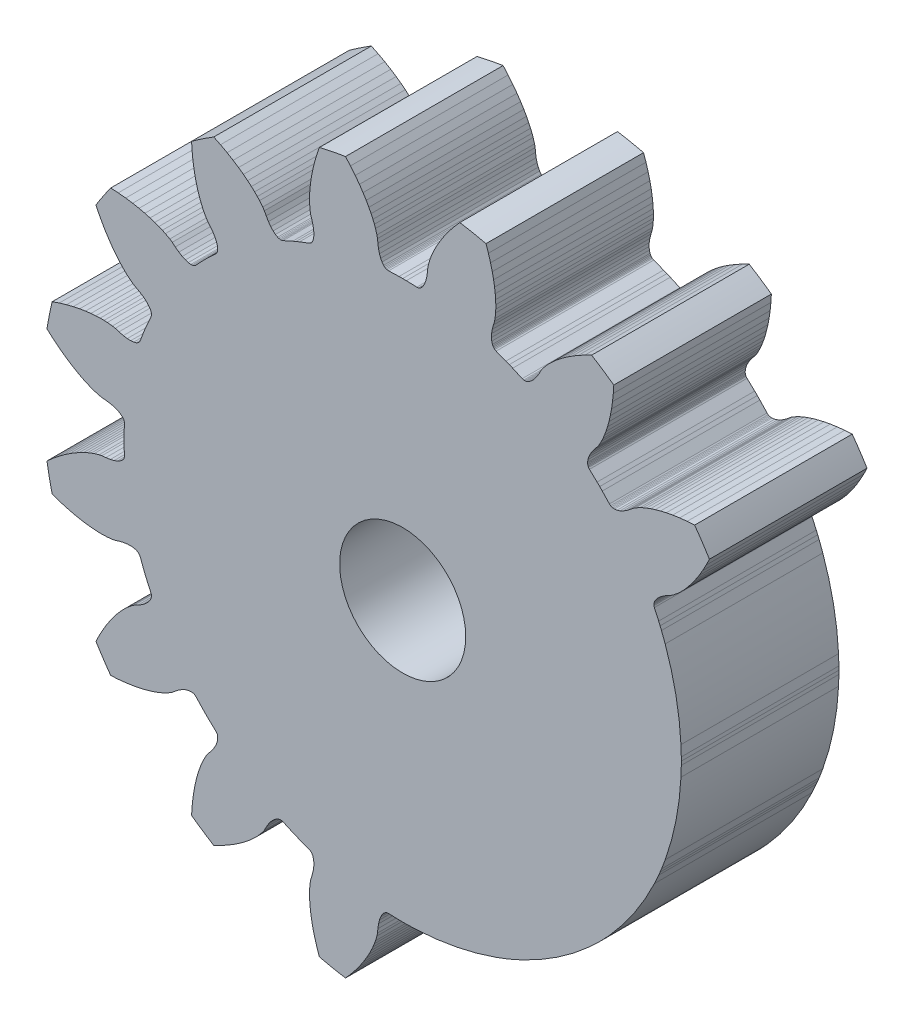
from build123d import *

# Parameters (mm, degrees)
MODEL_R             = 2
BOSS_EXTRUDE1_DEPTH = 5
CUT_EXTRUDE1_DEPTH  = 5


with BuildPart() as part:
    # Model → Boss-Extrude1 (new body)
    with BuildSketch(Plane.XY):
        with BuildLine():
            Line((0.6463668, -5.5709209), (0.5329274, -5.7804302))
            Line((0.5329274, -5.7804302), (0.428128836, -5.994577478))
            ThreePointArc((0.428128836, -5.994577478), (0.656324717, -6.350152722), (0.897506636, -6.697050974))
            Line((0.897506636, -6.697050974), (1.1354576, -6.6821803))
            Line((1.1354576, -6.6821803), (1.3724303, -6.6575518))
            Line((1.3724303, -6.6575518), (1.5929416, -6.6252582))
            Line((1.5929416, -6.6252582), (1.7947923, -6.5870179))
            Line((1.7947923, -6.5870179), (1.9798633, -6.5438349))
            Line((1.9798633, -6.5438349), (2.1448667, -6.497979))
            Line((2.1448667, -6.497979), (2.2934298, -6.4499099))
            Line((2.2934298, -6.4499099), (2.4236011, -6.4016922))
            Line((2.4236011, -6.4016922), (2.5361725, -6.3545282))
            Line((2.5361725, -6.3545282), (2.6306986, -6.3102209))
            Line((2.6306986, -6.3102209), (2.7717664, -6.2333867))
            Line((2.7717664, -6.2333867), (2.8499936, -6.1820578))
            Line((2.8499936, -6.1820578), (2.9454601, -6.1014971))
            Line((2.9454601, -6.1014971), (3.0591558, -6.0163968))
            Line((3.0591558, -6.0163968), (3.1666784, -5.9511309))
            Line((3.1666784, -5.9511309), (3.2665997, -5.9050063))
            Line((3.2665997, -5.9050063), (3.3574983, -5.8772524))
            Line((3.3574983, -5.8772524), (3.4380589, -5.8670064))
            Line((3.4380589, -5.8670064), (3.4740507, -5.8681519))
            Line((3.4740507, -5.8681519), (3.5069736, -5.8733279))
            Line((3.5069736, -5.8733279), (3.5366862, -5.8823789))
            Line((3.5366862, -5.8823789), (3.5630259, -5.8951987))
            Line((3.5630259, -5.8951987), (3.6006086, -5.9262336))
            Line((3.6006086, -5.9262336), (3.8275404, -6.1681561))
            Line((3.8275404, -6.1681561), (3.9091759, -6.2508239))
            Line((3.9091759, -6.2508239), (3.9918438, -6.3324594))
            Line((3.9918438, -6.3324594), (4.2337662, -6.5593912))
            Line((4.2337662, -6.5593912), (4.2648011, -6.5969739))
            Line((4.2648011, -6.5969739), (4.277621, -6.6233137))
            Line((4.277621, -6.6233137), (4.2866719, -6.6530263))
            Line((4.2866719, -6.6530263), (4.2918479, -6.6859492))
            Line((4.2918479, -6.6859492), (4.2929935, -6.7219409))
            Line((4.2929935, -6.7219409), (4.2827475, -6.8025016))
            Line((4.2827475, -6.8025016), (4.2549935, -6.8934002))
            Line((4.2549935, -6.8934002), (4.208869, -6.9933214))
            Line((4.208869, -6.9933214), (4.143603, -7.1008441))
            Line((4.143603, -7.1008441), (4.0585027, -7.2145398))
            Line((4.0585027, -7.2145398), (3.977942, -7.3100063))
            Line((3.977942, -7.3100063), (3.9266132, -7.3882335))
            Line((3.9266132, -7.3882335), (3.8497789, -7.5293013))
            Line((3.8497789, -7.5293013), (3.8054716, -7.6238273))
            Line((3.8054716, -7.6238273), (3.7583076, -7.7363987))
            Line((3.7583076, -7.7363987), (3.71009, -7.86657))
            Line((3.71009, -7.86657), (3.6620209, -8.0151331))
            Line((3.6620209, -8.0151331), (3.616165, -8.1801365))
            Line((3.616165, -8.1801365), (3.572982, -8.3652076))
            Line((3.572982, -8.3652076), (3.5347416, -8.5670583))
            Line((3.5347416, -8.5670583), (3.5024481, -8.7875695))
            Line((3.5024481, -8.7875695), (3.4778196, -9.0245422))
            Line((3.4778196, -9.0245422), (3.462948926, -9.262493164))
            ThreePointArc((3.462948926, -9.262493164), (3.809847597, -9.503674455), (4.165422422, -9.731870964))
            Line((4.165422422, -9.731870964), (4.3795697, -9.6270724))
            Line((4.3795697, -9.6270724), (4.589079, -9.5136331))
            Line((4.589079, -9.5136331), (4.7804466, -9.3994117))
            Line((4.7804466, -9.3994117), (4.9522984, -9.2868373))
            Line((4.9522984, -9.2868373), (5.1067563, -9.1761178))
            Line((5.1067563, -9.1761178), (5.2416513, -9.0706084))
            Line((5.2416513, -9.0706084), (5.3605105, -8.9693457))
            Line((5.3605105, -8.9693457), (5.462321, -8.8749841))
            Line((5.462321, -8.8749841), (5.5482745, -8.788331))
            Line((5.5482745, -8.788331), (5.6186495, -8.7112228))
            Line((5.6186495, -8.7112228), (5.719576, -8.5862529))
            Line((5.719576, -8.5862529), (5.7722058, -8.508895))
            Line((5.7722058, -8.508895), (5.8295761, -8.3979332))
            Line((5.8295761, -8.3979332), (5.9020507, -8.2758013))
            Line((5.9020507, -8.2758013), (5.9764125, -8.1743563))
            Line((5.9764125, -8.1743563), (6.0510766, -8.0935045))
            Line((6.0510766, -8.0935045), (6.124435, -8.0330778))
            Line((6.124435, -8.0330778), (6.1949424, -7.9927825))
            Line((6.1949424, -7.9927825), (6.2286328, -7.9800674))
            Line((6.2286328, -7.9800674), (6.2610303, -7.9722504))
            Line((6.2610303, -7.9722504), (6.2919449, -7.9692419))
            Line((6.2919449, -7.9692419), (6.3211855, -7.9710061))
            Line((6.3211855, -7.9710061), (6.367784, -7.9852963))
            Line((6.367784, -7.9852963), (6.6700213, -8.1219605))
            Line((6.6700213, -8.1219605), (6.7770783, -8.1670951))
            Line((6.7770783, -8.1670951), (6.884694, -8.2108808))
            Line((6.884694, -8.2108808), (7.1950442, -8.3279587))
            Line((7.1950442, -8.3279587), (7.238099, -8.3508041))
            Line((7.238099, -8.3508041), (7.2600228, -8.3702329))
            Line((7.2600228, -8.3702329), (7.2797553, -8.3942201))
            Line((7.2797553, -8.3942201), (7.2971364, -8.4226561))
            Line((7.2971364, -8.4226561), (7.3119682, -8.4554698))
            Line((7.3119682, -8.4554698), (7.3333313, -8.5338191))
            Line((7.3333313, -8.5338191), (7.3424754, -8.6284194))
            Line((7.3424754, -8.6284194), (7.3381001, -8.7383857))
            Line((7.3381001, -8.7383857), (7.3189493, -8.8626999))
            Line((7.3189493, -8.8626999), (7.2838364, -9.0003075))
            Line((7.2838364, -9.0003075), (7.2459415, -9.1193363))
            Line((7.2459415, -9.1193363), (7.228456, -9.2112515))
            Line((7.228456, -9.2112515), (7.2114548, -9.3709844))
            Line((7.2114548, -9.3709844), (7.2066937, -9.4752707))
            Line((7.2066937, -9.4752707), (7.206199, -9.597322))
            Line((7.206199, -9.597322), (7.2114662, -9.7360367))
            Line((7.2114662, -9.7360367), (7.2239087, -9.8916864))
            Line((7.2239087, -9.8916864), (7.2446875, -10.0616779))
            Line((7.2446875, -10.0616779), (7.2756152, -10.2491867))
            Line((7.2756152, -10.2491867), (7.3175307, -10.4503063))
            Line((7.3175307, -10.4503063), (7.3720813, -10.6663904))
            Line((7.3720813, -10.6663904), (7.440013, -10.8947495))
            Line((7.440013, -10.8947495), (7.517334202, -11.120278282))
            ThreePointArc((7.517334202, -11.120278282), (7.930122801, -11.210348752), (8.345958208, -11.285101885))
            Line((8.345958208, -11.285101885), (8.5036998, -11.10633))
            Line((8.5036998, -11.10633), (8.6538498, -10.92135))
            Line((8.6538498, -10.92135), (8.7869398, -10.74259))
            Line((8.7869398, -10.74259), (8.9026298, -10.57282))
            Line((8.9026298, -10.57282), (9.0029598, -10.41142))
            Line((9.0029598, -10.41142), (9.0872098, -10.26232))
            Line((9.0872098, -10.26232), (9.1582698, -10.12328))
            Line((9.1582698, -10.12328), (9.2162198, -9.99714))
            Line((9.2162198, -9.99714), (9.2624698, -9.88419))
            Line((9.2624698, -9.88419), (9.2979798, -9.78602))
            Line((9.2979798, -9.78602), (9.3433998, -9.63194))
            Line((9.3433998, -9.63194), (9.3624198, -9.54033))
            Line((9.3624198, -9.54033), (9.3729598, -9.41586))
            Line((9.3729598, -9.41586), (9.3931798, -9.27529))
            Line((9.3931798, -9.27529), (9.4230598, -9.15311))
            Line((9.4230598, -9.15311), (9.4610998, -9.04984))
            Line((9.4610998, -9.04984), (9.5057498, -8.96594))
            Line((9.5057498, -8.96594), (9.5554698, -8.90173))
            Line((9.5554698, -8.90173), (9.5817298, -8.87709))
            Line((9.5817298, -8.87709), (9.6086698, -8.85747))
            Line((9.6086698, -8.85747), (9.6360798, -8.84286))
            Line((9.6360798, -8.84286), (9.6637698, -8.8333))
            Line((9.6637698, -8.8333), (9.7122898, -8.82867))
            Line((9.7122898, -8.82867), (10.0438198, -8.83927))
            Line((10.0438198, -8.83927), (10.1599998, -8.84))
            Line((10.1599998, -8.84), (10.2761798, -8.83927))
            Line((10.2761798, -8.83927), (10.6077098, -8.82867))
            Line((10.6077098, -8.82867), (10.6562298, -8.8333))
            Line((10.6562298, -8.8333), (10.6839198, -8.84286))
            Line((10.6839198, -8.84286), (10.7113298, -8.85747))
            Line((10.7113298, -8.85747), (10.7382698, -8.87709))
            Line((10.7382698, -8.87709), (10.7645298, -8.90173))
            Line((10.7645298, -8.90173), (10.8142498, -8.96594))
            Line((10.8142498, -8.96594), (10.8588998, -9.04984))
            Line((10.8588998, -9.04984), (10.8969398, -9.15311))
            Line((10.8969398, -9.15311), (10.9268198, -9.27529))
            Line((10.9268198, -9.27529), (10.9470398, -9.41586))
            Line((10.9470398, -9.41586), (10.9575798, -9.54033))
            Line((10.9575798, -9.54033), (10.9765998, -9.63194))
            Line((10.9765998, -9.63194), (11.0220198, -9.78602))
            Line((11.0220198, -9.78602), (11.0575298, -9.88419))
            Line((11.0575298, -9.88419), (11.1037798, -9.99714))
            Line((11.1037798, -9.99714), (11.1617298, -10.12328))
            Line((11.1617298, -10.12328), (11.2327898, -10.26232))
            Line((11.2327898, -10.26232), (11.3170398, -10.41142))
            Line((11.3170398, -10.41142), (11.4173698, -10.57282))
            Line((11.4173698, -10.57282), (11.5330598, -10.74259))
            Line((11.5330598, -10.74259), (11.6661498, -10.92135))
            Line((11.6661498, -10.92135), (11.8162998, -11.10633))
            Line((11.8162998, -11.10633), (11.974041492, -11.285101985))
            ThreePointArc((11.974041492, -11.285101985), (12.389876826, -11.210348484), (12.802665498, -11.120278382))
            Line((12.802665498, -11.120278382), (12.8799867, -10.8947495))
            Line((12.8799867, -10.8947495), (12.9479184, -10.6663904))
            Line((12.9479184, -10.6663904), (13.002469, -10.4503063))
            Line((13.002469, -10.4503063), (13.0443845, -10.2491867))
            Line((13.0443845, -10.2491867), (13.0753122, -10.0616779))
            Line((13.0753122, -10.0616779), (13.096091, -9.8916864))
            Line((13.096091, -9.8916864), (13.1085335, -9.7360367))
            Line((13.1085335, -9.7360367), (13.1138007, -9.597322))
            Line((13.1138007, -9.597322), (13.113306, -9.4752707))
            Line((13.113306, -9.4752707), (13.1085449, -9.3709844))
            Line((13.1085449, -9.3709844), (13.0915437, -9.2112515))
            Line((13.0915437, -9.2112515), (13.0740582, -9.1193363))
            Line((13.0740582, -9.1193363), (13.0361633, -9.0003075))
            Line((13.0361633, -9.0003075), (13.0010504, -8.8626999))
            Line((13.0010504, -8.8626999), (12.9818996, -8.7383857))
            Line((12.9818996, -8.7383857), (12.9775243, -8.6284194))
            Line((12.9775243, -8.6284194), (12.9866684, -8.5338191))
            Line((12.9866684, -8.5338191), (13.0080315, -8.4554698))
            Line((13.0080315, -8.4554698), (13.0228633, -8.4226561))
            Line((13.0228633, -8.4226561), (13.0402444, -8.3942201))
            Line((13.0402444, -8.3942201), (13.0599769, -8.3702329))
            Line((13.0599769, -8.3702329), (13.0819007, -8.3508041))
            Line((13.0819007, -8.3508041), (13.1249555, -8.3279587))
            Line((13.1249555, -8.3279587), (13.4353057, -8.2108808))
            Line((13.4353057, -8.2108808), (13.5429214, -8.1670951))
            Line((13.5429214, -8.1670951), (13.6499784, -8.1219605))
            Line((13.6499784, -8.1219605), (13.9522157, -7.9852963))
            Line((13.9522157, -7.9852963), (13.9988142, -7.9710061))
            Line((13.9988142, -7.9710061), (14.0280548, -7.9692419))
            Line((14.0280548, -7.9692419), (14.0589694, -7.9722504))
            Line((14.0589694, -7.9722504), (14.0913669, -7.9800674))
            Line((14.0913669, -7.9800674), (14.1250573, -7.9927825))
            Line((14.1250573, -7.9927825), (14.1955647, -8.0330778))
            Line((14.1955647, -8.0330778), (14.2689231, -8.0935045))
            Line((14.2689231, -8.0935045), (14.3435872, -8.1743563))
            Line((14.3435872, -8.1743563), (14.417949, -8.2758013))
            Line((14.417949, -8.2758013), (14.4904236, -8.3979332))
            Line((14.4904236, -8.3979332), (14.5477939, -8.508895))
            Line((14.5477939, -8.508895), (14.6004237, -8.5862529))
            Line((14.6004237, -8.5862529), (14.7013502, -8.7112228))
            Line((14.7013502, -8.7112228), (14.7717252, -8.788331))
            Line((14.7717252, -8.788331), (14.8576787, -8.8749841))
            Line((14.8576787, -8.8749841), (14.9594892, -8.9693457))
            Line((14.9594892, -8.9693457), (15.0783484, -9.0706084))
            Line((15.0783484, -9.0706084), (15.2132434, -9.1761178))
            Line((15.2132434, -9.1761178), (15.3677013, -9.2868373))
            Line((15.3677013, -9.2868373), (15.5395531, -9.3994117))
            Line((15.5395531, -9.3994117), (15.7309207, -9.5136331))
            Line((15.7309207, -9.5136331), (15.94043, -9.6270724))
            Line((15.94043, -9.6270724), (16.154577278, -9.731870964))
            ThreePointArc((16.154577278, -9.731870964), (16.510152313, -9.503674769), (16.857050774, -9.262493164))
            Line((16.857050774, -9.262493164), (16.8421801, -9.0245422))
            Line((16.8421801, -9.0245422), (16.8175516, -8.7875695))
            Line((16.8175516, -8.7875695), (16.785258, -8.5670583))
            Line((16.785258, -8.5670583), (16.7470177, -8.3652076))
            Line((16.7470177, -8.3652076), (16.7038347, -8.1801365))
            Line((16.7038347, -8.1801365), (16.6579788, -8.0151331))
            Line((16.6579788, -8.0151331), (16.6099097, -7.86657))
            Line((16.6099097, -7.86657), (16.5616921, -7.7363987))
            Line((16.5616921, -7.7363987), (16.5145281, -7.6238273))
            Line((16.5145281, -7.6238273), (16.4702208, -7.5293013))
            Line((16.4702208, -7.5293013), (16.3933865, -7.3882335))
            Line((16.3933865, -7.3882335), (16.3420577, -7.3100063))
            Line((16.3420577, -7.3100063), (16.261497, -7.2145398))
            Line((16.261497, -7.2145398), (16.1763967, -7.1008441))
            Line((16.1763967, -7.1008441), (16.1111307, -6.9933214))
            Line((16.1111307, -6.9933214), (16.0650062, -6.8934002))
            Line((16.0650062, -6.8934002), (16.0372522, -6.8025016))
            Line((16.0372522, -6.8025016), (16.0270062, -6.7219409))
            Line((16.0270062, -6.7219409), (16.0281517, -6.6859492))
            Line((16.0281517, -6.6859492), (16.0333278, -6.6530263))
            Line((16.0333278, -6.6530263), (16.0423787, -6.6233137))
            Line((16.0423787, -6.6233137), (16.0551986, -6.5969739))
            Line((16.0551986, -6.5969739), (16.0862335, -6.5593912))
            Line((16.0862335, -6.5593912), (16.3281559, -6.3324594))
            Line((16.3281559, -6.3324594), (16.4108238, -6.2508239))
            Line((16.4108238, -6.2508239), (16.4924593, -6.1681561))
            Line((16.4924593, -6.1681561), (16.7193911, -5.9262336))
            Line((16.7193911, -5.9262336), (16.7569738, -5.8951987))
            Line((16.7569738, -5.8951987), (16.7833135, -5.8823789))
            Line((16.7833135, -5.8823789), (16.8130261, -5.8733279))
            Line((16.8130261, -5.8733279), (16.845949, -5.8681519))
            Line((16.845949, -5.8681519), (16.8819408, -5.8670064))
            Line((16.8819408, -5.8670064), (16.9625014, -5.8772524))
            Line((16.9625014, -5.8772524), (17.0534, -5.9050063))
            Line((17.0534, -5.9050063), (17.1533213, -5.9511309))
            Line((17.1533213, -5.9511309), (17.2608439, -6.0163968))
            Line((17.2608439, -6.0163968), (17.3745396, -6.1014971))
            Line((17.3745396, -6.1014971), (17.4700061, -6.1820578))
            Line((17.4700061, -6.1820578), (17.5482333, -6.2333867))
            Line((17.5482333, -6.2333867), (17.6893011, -6.3102209))
            Line((17.6893011, -6.3102209), (17.7838272, -6.3545282))
            Line((17.7838272, -6.3545282), (17.8963986, -6.4016922))
            Line((17.8963986, -6.4016922), (18.0265699, -6.4499099))
            Line((18.0265699, -6.4499099), (18.175133, -6.497979))
            Line((18.175133, -6.497979), (18.3401364, -6.5438349))
            Line((18.3401364, -6.5438349), (18.5252074, -6.5870179))
            Line((18.5252074, -6.5870179), (18.7270581, -6.6252582))
            Line((18.7270581, -6.6252582), (18.9475694, -6.6575518))
            Line((18.9475694, -6.6575518), (19.1845421, -6.6821803))
            Line((19.1845421, -6.6821803), (19.422493064, -6.697050974))
            ThreePointArc((19.422493064, -6.697050974), (19.663674357, -6.350152304), (19.891870864, -5.994577478))
            Line((19.891870864, -5.994577478), (19.7870722, -5.7804302))
            Line((19.7870722, -5.7804302), (19.6736329, -5.5709209))
            Line((19.6736329, -5.5709209), (19.5594116, -5.3795532))
            Line((19.5594116, -5.3795532), (19.4468372, -5.2077015))
            Line((19.4468372, -5.2077015), (19.3361177, -5.0532435))
            Line((19.3361177, -5.0532435), (19.2306083, -4.9183486))
            Line((19.2306083, -4.9183486), (19.1293456, -4.7994894))
            Line((19.1293456, -4.7994894), (19.0349839, -4.6976789))
            Line((19.0349839, -4.6976789), (18.9483308, -4.6117254))
            Line((18.9483308, -4.6117254), (18.8712227, -4.5413504))
            Line((18.8712227, -4.5413504), (18.7462528, -4.4404239))
            Line((18.7462528, -4.4404239), (18.6688948, -4.3877941))
            Line((18.6688948, -4.3877941), (18.557933, -4.3304238))
            Line((18.557933, -4.3304238), (18.4358011, -4.2579491))
            Line((18.4358011, -4.2579491), (18.3343561, -4.1835873))
            Line((18.3343561, -4.1835873), (18.2535043, -4.1089232))
            Line((18.2535043, -4.1089232), (18.1930777, -4.0355649))
            Line((18.1930777, -4.0355649), (18.1527824, -3.9650575))
            Line((18.1527824, -3.9650575), (18.1400673, -3.9313671))
            Line((18.1400673, -3.9313671), (18.1322502, -3.8989695))
            Line((18.1322502, -3.8989695), (18.1292417, -3.868055))
            Line((18.1292417, -3.868055), (18.1310059, -3.8388143))
            Line((18.1310059, -3.8388143), (18.1452962, -3.7922158))
            Line((18.1452962, -3.7922158), (18.2819603, -3.4899785))
            Line((18.2819603, -3.4899785), (18.3270949, -3.3829215))
            Line((18.3270949, -3.3829215), (18.3708806, -3.2753059))
            Line((18.3708806, -3.2753059), (18.4879586, -2.9649556))
            Line((18.4879586, -2.9649556), (18.5108039, -2.9219008))
            Line((18.5108039, -2.9219008), (18.5302327, -2.8999771))
            Line((18.5302327, -2.8999771), (18.5542199, -2.8802445))
            Line((18.5542199, -2.8802445), (18.582656, -2.8628635))
            Line((18.582656, -2.8628635), (18.6154696, -2.8480317))
            Line((18.6154696, -2.8480317), (18.6938189, -2.8266685))
            Line((18.6938189, -2.8266685), (18.7884192, -2.8175244))
            Line((18.7884192, -2.8175244), (18.8983856, -2.8218998))
            Line((18.8983856, -2.8218998), (19.0226997, -2.8410505))
            Line((19.0226997, -2.8410505), (19.1603074, -2.8761635))
            Line((19.1603074, -2.8761635), (19.2793361, -2.9140584))
            Line((19.2793361, -2.9140584), (19.3712514, -2.9315438))
            Line((19.3712514, -2.9315438), (19.5309842, -2.9485451))
            Line((19.5309842, -2.9485451), (19.6352705, -2.9533062))
            Line((19.6352705, -2.9533062), (19.7573218, -2.9538008))
            Line((19.7573218, -2.9538008), (19.8960365, -2.9485337))
            Line((19.8960365, -2.9485337), (20.0516862, -2.9360911))
            Line((20.0516862, -2.9360911), (20.2216777, -2.9153124))
            Line((20.2216777, -2.9153124), (20.4091865, -2.8843846))
            Line((20.4091865, -2.8843846), (20.6103062, -2.8424692))
            Line((20.6103062, -2.8424692), (20.8263902, -2.7879185))
            Line((20.8263902, -2.7879185), (21.0547494, -2.7199868))
            Line((21.0547494, -2.7199868), (21.280278182, -2.642665598))
            ThreePointArc((21.280278182, -2.642665598), (21.370348652, -2.229876999), (21.445101785, -1.814041592))
            Line((21.445101785, -1.814041592), (21.2663298, -1.6563))
            Line((21.2663298, -1.6563), (21.0813498, -1.50615))
            Line((21.0813498, -1.50615), (20.9025898, -1.37306))
            Line((20.9025898, -1.37306), (20.7328198, -1.25737))
            Line((20.7328198, -1.25737), (20.5714198, -1.15704))
            Line((20.5714198, -1.15704), (20.4223198, -1.07279))
            Line((20.4223198, -1.07279), (20.2832798, -1.00173))
            Line((20.2832798, -1.00173), (20.1571398, -0.94378))
            Line((20.1571398, -0.94378), (20.0441898, -0.89753))
            Line((20.0441898, -0.89753), (19.9460198, -0.86202))
            Line((19.9460198, -0.86202), (19.7919398, -0.8166))
            Line((19.7919398, -0.8166), (19.7003298, -0.79758))
            Line((19.7003298, -0.79758), (19.5758598, -0.78704))
            Line((19.5758598, -0.78704), (19.4352898, -0.76682))
            Line((19.4352898, -0.76682), (19.3131098, -0.73694))
            Line((19.3131098, -0.73694), (19.2098398, -0.6989))
            Line((19.2098398, -0.6989), (19.1259398, -0.65425))
            Line((19.1259398, -0.65425), (19.0617298, -0.60453))
            Line((19.0617298, -0.60453), (19.0370898, -0.57827))
            Line((19.0370898, -0.57827), (19.0174698, -0.55133))
            Line((19.0174698, -0.55133), (19.0028598, -0.52392))
            Line((19.0028598, -0.52392), (18.9932998, -0.49623))
            Line((18.9932998, -0.49623), (18.9886698, -0.44771))
            Line((18.9886698, -0.44771), (18.9992698, -0.11618))
            Line((18.9992698, -0.11618), (18.9999998, 0))
            Line((18.9999998, 0), (18.9992698, 0.11618))
            Line((18.9992698, 0.11618), (18.9886698, 0.44771))
            Line((18.9886698, 0.44771), (18.9932998, 0.49623))
            Line((18.9932998, 0.49623), (19.0028598, 0.52392))
            Line((19.0028598, 0.52392), (19.0174698, 0.55133))
            Line((19.0174698, 0.55133), (19.0370898, 0.57827))
            Line((19.0370898, 0.57827), (19.0617298, 0.60453))
            Line((19.0617298, 0.60453), (19.1259398, 0.65425))
            Line((19.1259398, 0.65425), (19.2098398, 0.6989))
            Line((19.2098398, 0.6989), (19.3131098, 0.73694))
            Line((19.3131098, 0.73694), (19.4352898, 0.76682))
            Line((19.4352898, 0.76682), (19.5758598, 0.78704))
            Line((19.5758598, 0.78704), (19.7003298, 0.79758))
            Line((19.7003298, 0.79758), (19.7919398, 0.8166))
            Line((19.7919398, 0.8166), (19.9460198, 0.86202))
            Line((19.9460198, 0.86202), (20.0441898, 0.89753))
            Line((20.0441898, 0.89753), (20.1571398, 0.94378))
            Line((20.1571398, 0.94378), (20.2832798, 1.00173))
            Line((20.2832798, 1.00173), (20.4223198, 1.07279))
            Line((20.4223198, 1.07279), (20.5714198, 1.15704))
            Line((20.5714198, 1.15704), (20.7328198, 1.25737))
            Line((20.7328198, 1.25737), (20.9025898, 1.37306))
            Line((20.9025898, 1.37306), (21.0813498, 1.50615))
            Line((21.0813498, 1.50615), (21.2663298, 1.6563))
            Line((21.2663298, 1.6563), (21.445101785, 1.814041592))
            ThreePointArc((21.445101785, 1.814041592), (21.370348287, 2.229876926), (21.280278182, 2.642665598))
            Line((21.280278182, 2.642665598), (21.0547494, 2.7199868))
            Line((21.0547494, 2.7199868), (20.8263902, 2.7879185))
            Line((20.8263902, 2.7879185), (20.6103062, 2.8424692))
            Line((20.6103062, 2.8424692), (20.4091865, 2.8843846))
            Line((20.4091865, 2.8843846), (20.2216777, 2.9153124))
            Line((20.2216777, 2.9153124), (20.0516862, 2.9360911))
            Line((20.0516862, 2.9360911), (19.8960365, 2.9485337))
            Line((19.8960365, 2.9485337), (19.7573218, 2.9538008))
            Line((19.7573218, 2.9538008), (19.6352705, 2.9533062))
            Line((19.6352705, 2.9533062), (19.5309842, 2.9485451))
            Line((19.5309842, 2.9485451), (19.3712514, 2.9315438))
            Line((19.3712514, 2.9315438), (19.2793361, 2.9140584))
            Line((19.2793361, 2.9140584), (19.1603074, 2.8761635))
            Line((19.1603074, 2.8761635), (19.0226997, 2.8410505))
            Line((19.0226997, 2.8410505), (18.8983856, 2.8218998))
            Line((18.8983856, 2.8218998), (18.7884192, 2.8175244))
            Line((18.7884192, 2.8175244), (18.6938189, 2.8266685))
            Line((18.6938189, 2.8266685), (18.6154696, 2.8480317))
            Line((18.6154696, 2.8480317), (18.582656, 2.8628635))
            Line((18.582656, 2.8628635), (18.5542199, 2.8802445))
            Line((18.5542199, 2.8802445), (18.5302327, 2.8999771))
            Line((18.5302327, 2.8999771), (18.5108039, 2.9219008))
            Line((18.5108039, 2.9219008), (18.4879586, 2.9649556))
            Line((18.4879586, 2.9649556), (18.3708806, 3.2753059))
            Line((18.3708806, 3.2753059), (18.3270949, 3.3829215))
            Line((18.3270949, 3.3829215), (18.2819603, 3.4899785))
            Line((18.2819603, 3.4899785), (18.1452962, 3.7922158))
            Line((18.1452962, 3.7922158), (18.1310059, 3.8388143))
            Line((18.1310059, 3.8388143), (18.1292417, 3.868055))
            Line((18.1292417, 3.868055), (18.1322502, 3.8989695))
            Line((18.1322502, 3.8989695), (18.1400673, 3.9313671))
            Line((18.1400673, 3.9313671), (18.1527824, 3.9650575))
            Line((18.1527824, 3.9650575), (18.1930777, 4.0355649))
            Line((18.1930777, 4.0355649), (18.2535043, 4.1089232))
            Line((18.2535043, 4.1089232), (18.3343561, 4.1835873))
            Line((18.3343561, 4.1835873), (18.4358011, 4.2579491))
            Line((18.4358011, 4.2579491), (18.557933, 4.3304238))
            Line((18.557933, 4.3304238), (18.6688948, 4.3877941))
            Line((18.6688948, 4.3877941), (18.7462528, 4.4404239))
            Line((18.7462528, 4.4404239), (18.8712227, 4.5413504))
            Line((18.8712227, 4.5413504), (18.9483308, 4.6117254))
            Line((18.9483308, 4.6117254), (19.0349839, 4.6976789))
            Line((19.0349839, 4.6976789), (19.1293456, 4.7994894))
            Line((19.1293456, 4.7994894), (19.2306083, 4.9183486))
            Line((19.2306083, 4.9183486), (19.3361177, 5.0532435))
            Line((19.3361177, 5.0532435), (19.4468372, 5.2077015))
            Line((19.4468372, 5.2077015), (19.5594116, 5.3795532))
            Line((19.5594116, 5.3795532), (19.6736329, 5.5709209))
            Line((19.6736329, 5.5709209), (19.7870722, 5.7804302))
            Line((19.7870722, 5.7804302), (19.891870864, 5.994577478))
            ThreePointArc((19.891870864, 5.994577478), (19.663674669, 6.350152513), (19.422493064, 6.697050974))
            Line((19.422493064, 6.697050974), (19.1845421, 6.6821803))
            Line((19.1845421, 6.6821803), (18.9475694, 6.6575518))
            Line((18.9475694, 6.6575518), (18.7270581, 6.6252582))
            Line((18.7270581, 6.6252582), (18.5252074, 6.5870179))
            Line((18.5252074, 6.5870179), (18.3401364, 6.5438349))
            Line((18.3401364, 6.5438349), (18.175133, 6.497979))
            Line((18.175133, 6.497979), (18.0265699, 6.4499099))
            Line((18.0265699, 6.4499099), (17.8963986, 6.4016922))
            Line((17.8963986, 6.4016922), (17.7838272, 6.3545282))
            Line((17.7838272, 6.3545282), (17.6893011, 6.3102209))
            Line((17.6893011, 6.3102209), (17.5482333, 6.2333867))
            Line((17.5482333, 6.2333867), (17.4700061, 6.1820578))
            Line((17.4700061, 6.1820578), (17.3745396, 6.1014971))
            Line((17.3745396, 6.1014971), (17.2608439, 6.0163968))
            Line((17.2608439, 6.0163968), (17.1533213, 5.9511309))
            Line((17.1533213, 5.9511309), (17.0534, 5.9050063))
            Line((17.0534, 5.9050063), (16.9625014, 5.8772524))
            Line((16.9625014, 5.8772524), (16.8819408, 5.8670064))
            Line((16.8819408, 5.8670064), (16.845949, 5.8681519))
            Line((16.845949, 5.8681519), (16.8130261, 5.8733279))
            Line((16.8130261, 5.8733279), (16.7833135, 5.8823789))
            Line((16.7833135, 5.8823789), (16.7569738, 5.8951987))
            Line((16.7569738, 5.8951987), (16.7193911, 5.9262336))
            Line((16.7193911, 5.9262336), (16.4924593, 6.1681561))
            Line((16.4924593, 6.1681561), (16.4108238, 6.2508239))
            Line((16.4108238, 6.2508239), (16.3281559, 6.3324594))
            Line((16.3281559, 6.3324594), (16.0862335, 6.5593912))
            Line((16.0862335, 6.5593912), (16.0551986, 6.5969739))
            Line((16.0551986, 6.5969739), (16.0423787, 6.6233137))
            Line((16.0423787, 6.6233137), (16.0333278, 6.6530263))
            Line((16.0333278, 6.6530263), (16.0281517, 6.6859492))
            Line((16.0281517, 6.6859492), (16.0270062, 6.7219409))
            Line((16.0270062, 6.7219409), (16.0372522, 6.8025016))
            Line((16.0372522, 6.8025016), (16.0650062, 6.8934002))
            Line((16.0650062, 6.8934002), (16.1111307, 6.9933214))
            Line((16.1111307, 6.9933214), (16.1763967, 7.1008441))
            Line((16.1763967, 7.1008441), (16.261497, 7.2145398))
            Line((16.261497, 7.2145398), (16.3420577, 7.3100063))
            Line((16.3420577, 7.3100063), (16.3933865, 7.3882335))
            Line((16.3933865, 7.3882335), (16.4702208, 7.5293013))
            Line((16.4702208, 7.5293013), (16.5145281, 7.6238273))
            Line((16.5145281, 7.6238273), (16.5616921, 7.7363987))
            Line((16.5616921, 7.7363987), (16.6099097, 7.86657))
            Line((16.6099097, 7.86657), (16.6579788, 8.0151331))
            Line((16.6579788, 8.0151331), (16.7038347, 8.1801365))
            Line((16.7038347, 8.1801365), (16.7470177, 8.3652076))
            Line((16.7470177, 8.3652076), (16.785258, 8.5670583))
            Line((16.785258, 8.5670583), (16.8175516, 8.7875695))
            Line((16.8175516, 8.7875695), (16.8421801, 9.0245422))
            Line((16.8421801, 9.0245422), (16.857050774, 9.262493164))
            ThreePointArc((16.857050774, 9.262493164), (16.510152103, 9.503674455), (16.154577278, 9.731870964))
            Line((16.154577278, 9.731870964), (15.94043, 9.6270724))
            Line((15.94043, 9.6270724), (15.7309207, 9.5136331))
            Line((15.7309207, 9.5136331), (15.5395531, 9.3994117))
            Line((15.5395531, 9.3994117), (15.3677013, 9.2868373))
            Line((15.3677013, 9.2868373), (15.2132434, 9.1761178))
            Line((15.2132434, 9.1761178), (15.0783484, 9.0706084))
            Line((15.0783484, 9.0706084), (14.9594892, 8.9693457))
            Line((14.9594892, 8.9693457), (14.8576787, 8.8749841))
            Line((14.8576787, 8.8749841), (14.7717252, 8.788331))
            Line((14.7717252, 8.788331), (14.7013502, 8.7112228))
            Line((14.7013502, 8.7112228), (14.6004237, 8.5862529))
            Line((14.6004237, 8.5862529), (14.5477939, 8.508895))
            Line((14.5477939, 8.508895), (14.4904236, 8.3979332))
            Line((14.4904236, 8.3979332), (14.417949, 8.2758013))
            Line((14.417949, 8.2758013), (14.3435872, 8.1743563))
            Line((14.3435872, 8.1743563), (14.2689231, 8.0935045))
            Line((14.2689231, 8.0935045), (14.1955647, 8.0330778))
            Line((14.1955647, 8.0330778), (14.1250573, 7.9927825))
            Line((14.1250573, 7.9927825), (14.0913669, 7.9800674))
            Line((14.0913669, 7.9800674), (14.0589694, 7.9722504))
            Line((14.0589694, 7.9722504), (14.0280548, 7.9692419))
            Line((14.0280548, 7.9692419), (13.9988142, 7.9710061))
            Line((13.9988142, 7.9710061), (13.9522157, 7.9852963))
            Line((13.9522157, 7.9852963), (13.6499784, 8.1219605))
            Line((13.6499784, 8.1219605), (13.5429214, 8.1670951))
            Line((13.5429214, 8.1670951), (13.4353057, 8.2108808))
            Line((13.4353057, 8.2108808), (13.1249555, 8.3279587))
            Line((13.1249555, 8.3279587), (13.0819007, 8.3508041))
            Line((13.0819007, 8.3508041), (13.0599769, 8.3702329))
            Line((13.0599769, 8.3702329), (13.0402444, 8.3942201))
            Line((13.0402444, 8.3942201), (13.0228633, 8.4226561))
            Line((13.0228633, 8.4226561), (13.0080315, 8.4554698))
            Line((13.0080315, 8.4554698), (12.9866684, 8.5338191))
            Line((12.9866684, 8.5338191), (12.9775243, 8.6284194))
            Line((12.9775243, 8.6284194), (12.9818996, 8.7383857))
            Line((12.9818996, 8.7383857), (13.0010504, 8.8626999))
            Line((13.0010504, 8.8626999), (13.0361633, 9.0003075))
            Line((13.0361633, 9.0003075), (13.0740582, 9.1193363))
            Line((13.0740582, 9.1193363), (13.0915437, 9.2112515))
            Line((13.0915437, 9.2112515), (13.1085449, 9.3709844))
            Line((13.1085449, 9.3709844), (13.113306, 9.4752707))
            Line((13.113306, 9.4752707), (13.1138007, 9.597322))
            Line((13.1138007, 9.597322), (13.1085335, 9.7360367))
            Line((13.1085335, 9.7360367), (13.096091, 9.8916864))
            Line((13.096091, 9.8916864), (13.0753122, 10.0616779))
            Line((13.0753122, 10.0616779), (13.0443845, 10.2491867))
            Line((13.0443845, 10.2491867), (13.002469, 10.4503063))
            Line((13.002469, 10.4503063), (12.9479184, 10.6663904))
            Line((12.9479184, 10.6663904), (12.8799867, 10.8947495))
            Line((12.8799867, 10.8947495), (12.802665498, 11.120278282))
            ThreePointArc((12.802665498, 11.120278282), (12.389876899, 11.210348752), (11.974041492, 11.285101885))
            Line((11.974041492, 11.285101885), (11.8162998, 11.10633))
            Line((11.8162998, 11.10633), (11.6661498, 10.92135))
            Line((11.6661498, 10.92135), (11.5330598, 10.74259))
            Line((11.5330598, 10.74259), (11.4173698, 10.57282))
            Line((11.4173698, 10.57282), (11.3170398, 10.41142))
            Line((11.3170398, 10.41142), (11.2327898, 10.26232))
            Line((11.2327898, 10.26232), (11.1617298, 10.12328))
            Line((11.1617298, 10.12328), (11.1037798, 9.99714))
            Line((11.1037798, 9.99714), (11.0575298, 9.88419))
            Line((11.0575298, 9.88419), (11.0220198, 9.78602))
            Line((11.0220198, 9.78602), (10.9765998, 9.63194))
            Line((10.9765998, 9.63194), (10.9575798, 9.54033))
            Line((10.9575798, 9.54033), (10.9470398, 9.41586))
            Line((10.9470398, 9.41586), (10.9268198, 9.27529))
            Line((10.9268198, 9.27529), (10.8969398, 9.15311))
            Line((10.8969398, 9.15311), (10.8588998, 9.04984))
            Line((10.8588998, 9.04984), (10.8142498, 8.96594))
            Line((10.8142498, 8.96594), (10.7645298, 8.90173))
            Line((10.7645298, 8.90173), (10.7382698, 8.87709))
            Line((10.7382698, 8.87709), (10.7113298, 8.85747))
            Line((10.7113298, 8.85747), (10.6839198, 8.84286))
            Line((10.6839198, 8.84286), (10.6562298, 8.8333))
            Line((10.6562298, 8.8333), (10.6077098, 8.82867))
            Line((10.6077098, 8.82867), (10.2761798, 8.83927))
            Line((10.2761798, 8.83927), (10.1599998, 8.84))
            Line((10.1599998, 8.84), (10.0438198, 8.83927))
            Line((10.0438198, 8.83927), (9.7122898, 8.82867))
            Line((9.7122898, 8.82867), (9.6637698, 8.8333))
            Line((9.6637698, 8.8333), (9.6360798, 8.84286))
            Line((9.6360798, 8.84286), (9.6086698, 8.85747))
            Line((9.6086698, 8.85747), (9.5817298, 8.87709))
            Line((9.5817298, 8.87709), (9.5554698, 8.90173))
            Line((9.5554698, 8.90173), (9.5057498, 8.96594))
            Line((9.5057498, 8.96594), (9.4610998, 9.04984))
            Line((9.4610998, 9.04984), (9.4230598, 9.15311))
            Line((9.4230598, 9.15311), (9.3931798, 9.27529))
            Line((9.3931798, 9.27529), (9.3729598, 9.41586))
            Line((9.3729598, 9.41586), (9.3624198, 9.54033))
            Line((9.3624198, 9.54033), (9.3433998, 9.63194))
            Line((9.3433998, 9.63194), (9.2979798, 9.78602))
            Line((9.2979798, 9.78602), (9.2624698, 9.88419))
            Line((9.2624698, 9.88419), (9.2162198, 9.99714))
            Line((9.2162198, 9.99714), (9.1582698, 10.12328))
            Line((9.1582698, 10.12328), (9.0872098, 10.26232))
            Line((9.0872098, 10.26232), (9.0029598, 10.41142))
            Line((9.0029598, 10.41142), (8.9026298, 10.57282))
            Line((8.9026298, 10.57282), (8.7869398, 10.74259))
            Line((8.7869398, 10.74259), (8.6538498, 10.92135))
            Line((8.6538498, 10.92135), (8.5036998, 11.10633))
            Line((8.5036998, 11.10633), (8.345958208, 11.285101985))
            ThreePointArc((8.345958208, 11.285101985), (7.930122874, 11.210348484), (7.517334202, 11.120278382))
            Line((7.517334202, 11.120278382), (7.440013, 10.8947495))
            Line((7.440013, 10.8947495), (7.3720813, 10.6663904))
            Line((7.3720813, 10.6663904), (7.3175307, 10.4503063))
            Line((7.3175307, 10.4503063), (7.2756152, 10.2491867))
            Line((7.2756152, 10.2491867), (7.2446875, 10.0616779))
            Line((7.2446875, 10.0616779), (7.2239087, 9.8916864))
            Line((7.2239087, 9.8916864), (7.2114662, 9.7360367))
            Line((7.2114662, 9.7360367), (7.206199, 9.597322))
            Line((7.206199, 9.597322), (7.2066937, 9.4752707))
            Line((7.2066937, 9.4752707), (7.2114548, 9.3709844))
            Line((7.2114548, 9.3709844), (7.228456, 9.2112515))
            Line((7.228456, 9.2112515), (7.2459415, 9.1193363))
            Line((7.2459415, 9.1193363), (7.2838364, 9.0003075))
            Line((7.2838364, 9.0003075), (7.3189493, 8.8626999))
            Line((7.3189493, 8.8626999), (7.3381001, 8.7383857))
            Line((7.3381001, 8.7383857), (7.3424754, 8.6284194))
            Line((7.3424754, 8.6284194), (7.3333313, 8.5338191))
            Line((7.3333313, 8.5338191), (7.3119682, 8.4554698))
            Line((7.3119682, 8.4554698), (7.2971364, 8.4226561))
            Line((7.2971364, 8.4226561), (7.2797553, 8.3942201))
            Line((7.2797553, 8.3942201), (7.2600228, 8.3702329))
            Line((7.2600228, 8.3702329), (7.238099, 8.3508041))
            Line((7.238099, 8.3508041), (7.1950442, 8.3279587))
            Line((7.1950442, 8.3279587), (6.884694, 8.2108808))
            Line((6.884694, 8.2108808), (6.7770783, 8.1670951))
            Line((6.7770783, 8.1670951), (6.6700213, 8.1219605))
            Line((6.6700213, 8.1219605), (6.367784, 7.9852963))
            Line((6.367784, 7.9852963), (6.3211855, 7.9710061))
            Line((6.3211855, 7.9710061), (6.2919449, 7.9692419))
            Line((6.2919449, 7.9692419), (6.2610303, 7.9722504))
            Line((6.2610303, 7.9722504), (6.2286328, 7.9800674))
            Line((6.2286328, 7.9800674), (6.1949424, 7.9927825))
            Line((6.1949424, 7.9927825), (6.124435, 8.0330778))
            Line((6.124435, 8.0330778), (6.0510766, 8.0935045))
            Line((6.0510766, 8.0935045), (5.9764125, 8.1743563))
            Line((5.9764125, 8.1743563), (5.9020507, 8.2758013))
            Line((5.9020507, 8.2758013), (5.8295761, 8.3979332))
            Line((5.8295761, 8.3979332), (5.7722058, 8.508895))
            Line((5.7722058, 8.508895), (5.719576, 8.5862529))
            Line((5.719576, 8.5862529), (5.6186495, 8.7112228))
            Line((5.6186495, 8.7112228), (5.5482745, 8.788331))
            Line((5.5482745, 8.788331), (5.462321, 8.8749841))
            Line((5.462321, 8.8749841), (5.3605105, 8.9693457))
            Line((5.3605105, 8.9693457), (5.2416513, 9.0706084))
            Line((5.2416513, 9.0706084), (5.1067563, 9.1761178))
            Line((5.1067563, 9.1761178), (4.9522984, 9.2868373))
            Line((4.9522984, 9.2868373), (4.7804466, 9.3994117))
            Line((4.7804466, 9.3994117), (4.589079, 9.5136331))
            Line((4.589079, 9.5136331), (4.3795697, 9.6270724))
            Line((4.3795697, 9.6270724), (4.165422422, 9.731870964))
            ThreePointArc((4.165422422, 9.731870964), (3.809847387, 9.503674769), (3.462948926, 9.262493164))
            Line((3.462948926, 9.262493164), (3.4778196, 9.0245422))
            Line((3.4778196, 9.0245422), (3.5024481, 8.7875695))
            Line((3.5024481, 8.7875695), (3.5347416, 8.5670583))
            Line((3.5347416, 8.5670583), (3.572982, 8.3652076))
            Line((3.572982, 8.3652076), (3.616165, 8.1801365))
            Line((3.616165, 8.1801365), (3.6620209, 8.0151331))
            Line((3.6620209, 8.0151331), (3.71009, 7.86657))
            Line((3.71009, 7.86657), (3.7583076, 7.7363987))
            Line((3.7583076, 7.7363987), (3.8054716, 7.6238273))
            Line((3.8054716, 7.6238273), (3.8497789, 7.5293013))
            Line((3.8497789, 7.5293013), (3.9266132, 7.3882335))
            Line((3.9266132, 7.3882335), (3.977942, 7.3100063))
            Line((3.977942, 7.3100063), (4.0585027, 7.2145398))
            Line((4.0585027, 7.2145398), (4.143603, 7.1008441))
            Line((4.143603, 7.1008441), (4.208869, 6.9933214))
            Line((4.208869, 6.9933214), (4.2549935, 6.8934002))
            Line((4.2549935, 6.8934002), (4.2827475, 6.8025016))
            Line((4.2827475, 6.8025016), (4.2929935, 6.7219409))
            Line((4.2929935, 6.7219409), (4.2918479, 6.6859492))
            Line((4.2918479, 6.6859492), (4.2866719, 6.6530263))
            Line((4.2866719, 6.6530263), (4.277621, 6.6233137))
            Line((4.277621, 6.6233137), (4.2648011, 6.5969739))
            Line((4.2648011, 6.5969739), (4.2337662, 6.5593912))
            Line((4.2337662, 6.5593912), (3.9918438, 6.3324594))
            Line((3.9918438, 6.3324594), (3.9091759, 6.2508239))
            Line((3.9091759, 6.2508239), (3.8275404, 6.1681561))
            Line((3.8275404, 6.1681561), (3.6006086, 5.9262336))
            Line((3.6006086, 5.9262336), (3.5630259, 5.8951987))
            Line((3.5630259, 5.8951987), (3.5366862, 5.8823789))
            Line((3.5366862, 5.8823789), (3.5069736, 5.8733279))
            Line((3.5069736, 5.8733279), (3.4740507, 5.8681519))
            Line((3.4740507, 5.8681519), (3.4380589, 5.8670064))
            Line((3.4380589, 5.8670064), (3.3574983, 5.8772524))
            Line((3.3574983, 5.8772524), (3.2665997, 5.9050063))
            Line((3.2665997, 5.9050063), (3.1666784, 5.9511309))
            Line((3.1666784, 5.9511309), (3.0591558, 6.0163968))
            Line((3.0591558, 6.0163968), (2.9454601, 6.1014971))
            Line((2.9454601, 6.1014971), (2.8499936, 6.1820578))
            Line((2.8499936, 6.1820578), (2.7717664, 6.2333867))
            Line((2.7717664, 6.2333867), (2.6306986, 6.3102209))
            Line((2.6306986, 6.3102209), (2.5361725, 6.3545282))
            Line((2.5361725, 6.3545282), (2.4236011, 6.4016922))
            Line((2.4236011, 6.4016922), (2.2934298, 6.4499099))
            Line((2.2934298, 6.4499099), (2.1448667, 6.497979))
            Line((2.1448667, 6.497979), (1.9798633, 6.5438349))
            Line((1.9798633, 6.5438349), (1.7947923, 6.5870179))
            Line((1.7947923, 6.5870179), (1.5929416, 6.6252582))
            Line((1.5929416, 6.6252582), (1.3724303, 6.6575518))
            Line((1.3724303, 6.6575518), (1.1354576, 6.6821803))
            Line((1.1354576, 6.6821803), (0.897506636, 6.697050974))
            ThreePointArc((0.897506636, 6.697050974), (0.656325343, 6.350152304), (0.428128836, 5.994577478))
            Line((0.428128836, 5.994577478), (0.5329274, 5.7804302))
            Line((0.5329274, 5.7804302), (0.6463668, 5.5709209))
            Line((0.6463668, 5.5709209), (0.7605881, 5.3795532))
            Line((0.7605881, 5.3795532), (0.8731625, 5.2077015))
            Line((0.8731625, 5.2077015), (0.983882, 5.0532435))
            Line((0.983882, 5.0532435), (1.0893914, 4.9183486))
            Line((1.0893914, 4.9183486), (1.1906541, 4.7994894))
            Line((1.1906541, 4.7994894), (1.2850158, 4.6976789))
            Line((1.2850158, 4.6976789), (1.3716689, 4.6117254))
            Line((1.3716689, 4.6117254), (1.448777, 4.5413504))
            Line((1.448777, 4.5413504), (1.5737469, 4.4404239))
            Line((1.5737469, 4.4404239), (1.6511049, 4.3877941))
            Line((1.6511049, 4.3877941), (1.7620667, 4.3304238))
            Line((1.7620667, 4.3304238), (1.8841986, 4.2579491))
            Line((1.8841986, 4.2579491), (1.9856436, 4.1835873))
            Line((1.9856436, 4.1835873), (2.0664953, 4.1089232))
            Line((2.0664953, 4.1089232), (2.126922, 4.0355649))
            Line((2.126922, 4.0355649), (2.1672173, 3.9650575))
            Line((2.1672173, 3.9650575), (2.1799324, 3.9313671))
            Line((2.1799324, 3.9313671), (2.1877495, 3.8989695))
            Line((2.1877495, 3.8989695), (2.190758, 3.868055))
            Line((2.190758, 3.868055), (2.1889938, 3.8388143))
            Line((2.1889938, 3.8388143), (2.1747035, 3.7922158))
            Line((2.1747035, 3.7922158), (2.0380394, 3.4899785))
            Line((2.0380394, 3.4899785), (1.9929048, 3.3829215))
            Line((1.9929048, 3.3829215), (1.9491191, 3.2753059))
            Line((1.9491191, 3.2753059), (1.8320411, 2.9649556))
            Line((1.8320411, 2.9649556), (1.8091958, 2.9219008))
            Line((1.8091958, 2.9219008), (1.789767, 2.8999771))
            Line((1.789767, 2.8999771), (1.7657797, 2.8802445))
            Line((1.7657797, 2.8802445), (1.7373437, 2.8628635))
            Line((1.7373437, 2.8628635), (1.7045301, 2.8480317))
            Line((1.7045301, 2.8480317), (1.6261808, 2.8266685))
            Line((1.6261808, 2.8266685), (1.5315804, 2.8175244))
            Line((1.5315804, 2.8175244), (1.4216141, 2.8218998))
            Line((1.4216141, 2.8218998), (1.2972999, 2.8410505))
            Line((1.2972999, 2.8410505), (1.1596923, 2.8761635))
            Line((1.1596923, 2.8761635), (1.0406636, 2.9140584))
            Line((1.0406636, 2.9140584), (0.9487483, 2.9315438))
            Line((0.9487483, 2.9315438), (0.7890155, 2.9485451))
            Line((0.7890155, 2.9485451), (0.6847291, 2.9533062))
            Line((0.6847291, 2.9533062), (0.5626778, 2.9538008))
            Line((0.5626778, 2.9538008), (0.4239632, 2.9485337))
            Line((0.4239632, 2.9485337), (0.2683135, 2.9360911))
            Line((0.2683135, 2.9360911), (0.098322, 2.9153124))
            Line((0.098322, 2.9153124), (-0.0891868, 2.8843846))
            Line((-0.0891868, 2.8843846), (-0.2903065, 2.8424692))
            Line((-0.2903065, 2.8424692), (-0.5063905, 2.7879185))
            Line((-0.5063905, 2.7879185), (-0.7347497, 2.7199868))
            Line((-0.7347497, 2.7199868), (-0.960278482, 2.642665598))
            ThreePointArc((-0.960278482, 2.642665598), (-1.050348952, 2.229876999), (-1.125102085, 1.814041592))
            Line((-1.125102085, 1.814041592), (-0.9463302, 1.6563))
            Line((-0.9463302, 1.6563), (-0.7613502, 1.50615))
            Line((-0.7613502, 1.50615), (-0.5825902, 1.37306))
            Line((-0.5825902, 1.37306), (-0.4128202, 1.25737))
            Line((-0.4128202, 1.25737), (-0.2514202, 1.15704))
            Line((-0.2514202, 1.15704), (-0.1023202, 1.07279))
            Line((-0.1023202, 1.07279), (0.0367198, 1.00173))
            Line((0.0367198, 1.00173), (0.1628598, 0.94378))
            Line((0.1628598, 0.94378), (0.2758098, 0.89753))
            Line((0.2758098, 0.89753), (0.3739798, 0.86202))
            Line((0.3739798, 0.86202), (0.5280598, 0.8166))
            Line((0.5280598, 0.8166), (0.6196698, 0.79758))
            Line((0.6196698, 0.79758), (0.7441398, 0.78704))
            Line((0.7441398, 0.78704), (0.8847098, 0.76682))
            Line((0.8847098, 0.76682), (1.0068898, 0.73694))
            Line((1.0068898, 0.73694), (1.1101598, 0.6989))
            Line((1.1101598, 0.6989), (1.1940598, 0.65425))
            Line((1.1940598, 0.65425), (1.2582698, 0.60453))
            Line((1.2582698, 0.60453), (1.2829098, 0.57827))
            Line((1.2829098, 0.57827), (1.3025298, 0.55133))
            Line((1.3025298, 0.55133), (1.3171398, 0.52392))
            Line((1.3171398, 0.52392), (1.3266998, 0.49623))
            Line((1.3266998, 0.49623), (1.3313298, 0.44771))
            Line((1.3313298, 0.44771), (1.3207298, 0.11618))
            Line((1.3207298, 0.11618), (1.3199998, 0))
            Line((1.3199998, 0), (1.3207298, -0.11618))
            Line((1.3207298, -0.11618), (1.3313298, -0.44771))
            Line((1.3313298, -0.44771), (1.3266998, -0.49623))
            Line((1.3266998, -0.49623), (1.3171398, -0.52392))
            Line((1.3171398, -0.52392), (1.3025298, -0.55133))
            Line((1.3025298, -0.55133), (1.2829098, -0.57827))
            Line((1.2829098, -0.57827), (1.2582698, -0.60453))
            Line((1.2582698, -0.60453), (1.1940598, -0.65425))
            Line((1.1940598, -0.65425), (1.1101598, -0.6989))
            Line((1.1101598, -0.6989), (1.0068898, -0.73694))
            Line((1.0068898, -0.73694), (0.8847098, -0.76682))
            Line((0.8847098, -0.76682), (0.7441398, -0.78704))
            Line((0.7441398, -0.78704), (0.6196698, -0.79758))
            Line((0.6196698, -0.79758), (0.5280598, -0.8166))
            Line((0.5280598, -0.8166), (0.3739798, -0.86202))
            Line((0.3739798, -0.86202), (0.2758098, -0.89753))
            Line((0.2758098, -0.89753), (0.1628598, -0.94378))
            Line((0.1628598, -0.94378), (0.0367198, -1.00173))
            Line((0.0367198, -1.00173), (-0.1023202, -1.07279))
            Line((-0.1023202, -1.07279), (-0.2514202, -1.15704))
            Line((-0.2514202, -1.15704), (-0.4128202, -1.25737))
            Line((-0.4128202, -1.25737), (-0.5825902, -1.37306))
            Line((-0.5825902, -1.37306), (-0.7613502, -1.50615))
            Line((-0.7613502, -1.50615), (-0.9463302, -1.6563))
            Line((-0.9463302, -1.6563), (-1.125102085, -1.814041592))
            ThreePointArc((-1.125102085, -1.814041592), (-1.050348952, -2.229876999), (-0.960278482, -2.642665598))
            Line((-0.960278482, -2.642665598), (-0.7347497, -2.7199868))
            Line((-0.7347497, -2.7199868), (-0.5063905, -2.7879185))
            Line((-0.5063905, -2.7879185), (-0.2903065, -2.8424692))
            Line((-0.2903065, -2.8424692), (-0.0891868, -2.8843846))
            Line((-0.0891868, -2.8843846), (0.098322, -2.9153124))
            Line((0.098322, -2.9153124), (0.2683135, -2.9360911))
            Line((0.2683135, -2.9360911), (0.4239632, -2.9485337))
            Line((0.4239632, -2.9485337), (0.5626778, -2.9538008))
            Line((0.5626778, -2.9538008), (0.6847291, -2.9533062))
            Line((0.6847291, -2.9533062), (0.7890155, -2.9485451))
            Line((0.7890155, -2.9485451), (0.9487483, -2.9315438))
            Line((0.9487483, -2.9315438), (1.0406636, -2.9140584))
            Line((1.0406636, -2.9140584), (1.1596923, -2.8761635))
            Line((1.1596923, -2.8761635), (1.2972999, -2.8410505))
            Line((1.2972999, -2.8410505), (1.4216141, -2.8218998))
            Line((1.4216141, -2.8218998), (1.5315804, -2.8175244))
            Line((1.5315804, -2.8175244), (1.6261808, -2.8266685))
            Line((1.6261808, -2.8266685), (1.7045301, -2.8480317))
            Line((1.7045301, -2.8480317), (1.7373437, -2.8628635))
            Line((1.7373437, -2.8628635), (1.7657797, -2.8802445))
            Line((1.7657797, -2.8802445), (1.789767, -2.8999771))
            Line((1.789767, -2.8999771), (1.8091958, -2.9219008))
            Line((1.8091958, -2.9219008), (1.8320411, -2.9649556))
            Line((1.8320411, -2.9649556), (1.9491191, -3.2753059))
            Line((1.9491191, -3.2753059), (1.9929048, -3.3829215))
            Line((1.9929048, -3.3829215), (2.0380394, -3.4899785))
            Line((2.0380394, -3.4899785), (2.1747035, -3.7922158))
            Line((2.1747035, -3.7922158), (2.1889938, -3.8388143))
            Line((2.1889938, -3.8388143), (2.190758, -3.868055))
            Line((2.190758, -3.868055), (2.1877495, -3.8989695))
            Line((2.1877495, -3.8989695), (2.1799324, -3.9313671))
            Line((2.1799324, -3.9313671), (2.1672173, -3.9650575))
            Line((2.1672173, -3.9650575), (2.126922, -4.0355649))
            Line((2.126922, -4.0355649), (2.0664953, -4.1089232))
            Line((2.0664953, -4.1089232), (1.9856436, -4.1835873))
            Line((1.9856436, -4.1835873), (1.8841986, -4.2579491))
            Line((1.8841986, -4.2579491), (1.7620667, -4.3304238))
            Line((1.7620667, -4.3304238), (1.6511049, -4.3877941))
            Line((1.6511049, -4.3877941), (1.5737469, -4.4404239))
            Line((1.5737469, -4.4404239), (1.448777, -4.5413504))
            Line((1.448777, -4.5413504), (1.3716689, -4.6117254))
            Line((1.3716689, -4.6117254), (1.2850158, -4.6976789))
            Line((1.2850158, -4.6976789), (1.1906541, -4.7994894))
            Line((1.1906541, -4.7994894), (1.0893914, -4.9183486))
            Line((1.0893914, -4.9183486), (0.983882, -5.0532435))
            Line((0.983882, -5.0532435), (0.8731625, -5.2077015))
            Line((0.8731625, -5.2077015), (0.7605881, -5.3795532))
            Line((0.7605881, -5.3795532), (0.6463668, -5.5709209))
        make_face()
        with Locations((10.1599998, 0)):
            Circle(MODEL_R, mode=Mode.SUBTRACT)
    extrude(amount=BOSS_EXTRUDE1_DEPTH)

    # Sketch2 → Cut-Extrude1 (cut)
    with BuildSketch(Plane.XY.offset(5)):
        with BuildLine():
            Line((26.320578593, 8.03295889), (18.349168488, 3.329220349))
            ThreePointArc((18.349168488, 3.329220349), (18.835791329, 1.696123014), (19.00003328, 0))
            ThreePointArc((19.00003328, 0), (16.41084742, -6.25084762), (10.1599998, -8.84003348))
            Line((10.1599998, -8.84003348), (10.1599998, -13.371587557))
            Line((10.1599998, -13.371587557), (16.710348757, -12.617226024))
            Line((16.710348757, -12.617226024), (26.320578593, -6.543046756))
            Line((26.320578593, -6.543046756), (27.293932614, -1.554607397))
            Line((27.293932614, -1.554607397), (35.126158173, 3.644385233))
            Line((35.126158173, 3.644385233), (26.320578593, 8.03295889))
        make_face()
    extrude(amount=-CUT_EXTRUDE1_DEPTH, mode=Mode.SUBTRACT)


solid = part.part
